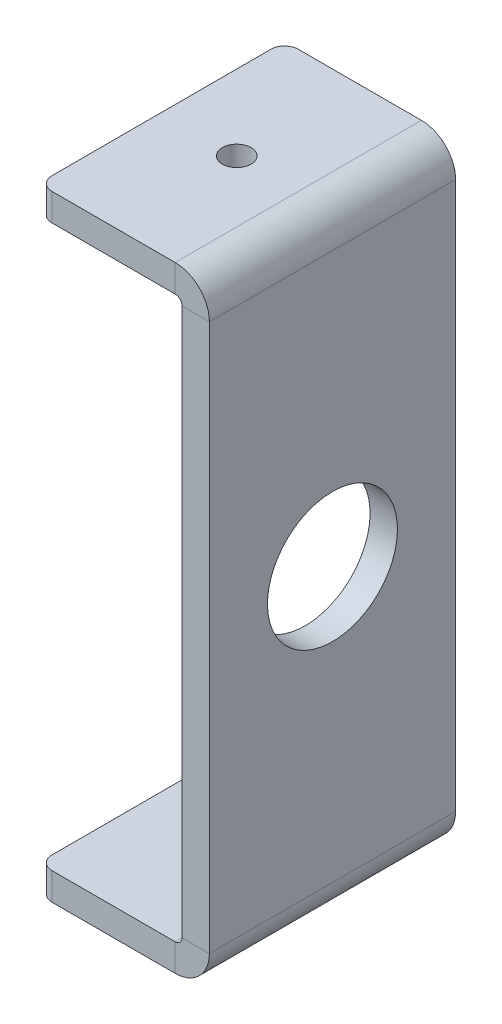
from build123d import *

# Parameters (mm, degrees)
BASE_FLANGE1_START    = -18
BASE_FLANGE1_DEPTH    = 36
FILLET1_R             = 2
M5_TAPPED_HOLE1_D     = 4.2
M5_TAPPED_HOLE1_DEPTH = 4
SKETCH8_R             = 9.5
CUT_EXTRUDE1_DEPTH    = 55.534392818


# Read off the part's stored shape, not the designer's step: Base-Flange1
with BuildPart() as part:
    # Base-Flange1 outline → Base-Flange1 (new body)
    with BuildSketch(Plane.XY.offset(BASE_FLANGE1_START)):
        with BuildLine():
            Line((-5, 45), (-25, 45))
            Line((-25, 45), (-25, 41))
            Line((-25, 41), (-5, 41))
            ThreePointArc((-5, 41), (-4.292893219, 40.707106781), (-4, 40))
            Line((-4, 40), (-4, -40))
            ThreePointArc((-4, -40), (-4.292893219, -40.707106781), (-5, -41))
            Line((-5, -41), (-25, -41))
            Line((-25, -41), (-25, -45))
            Line((-25, -45), (-5, -45))
            ThreePointArc((-5, -45), (-1.464466094, -43.535533906), (0, -40))
            Line((0, -40), (0, 40))
            ThreePointArc((0, 40), (-1.464466094, 43.535533906), (-5, 45))
        make_face()
    extrude(amount=BASE_FLANGE1_DEPTH)

    # Fillet1
    fillet1_edges = [part.edges().sort_by_distance(p)[0] for p in [
        (-25, -43, -18),
        (-25, 43, -18),
        (-25, -43, 18),
        (-25, 43, 18),
    ]]
    fillet(fillet1_edges, radius=FILLET1_R)

    # M5 Tapped Hole1
    with Locations(Plane(origin=(0, 45, 0), x_dir=(1, 0, 0), z_dir=(0, 1, 0))):
        with Locations((-14, 0)):
            m5_tapped_hole1 = Hole(M5_TAPPED_HOLE1_D / 2, depth=M5_TAPPED_HOLE1_DEPTH)

    # Mirror1: M5 Tapped Hole1 across plane
    add(m5_tapped_hole1.mirror(Plane.ZX), mode=Mode.SUBTRACT)

    # Sketch8 → Cut-Extrude1 (cut, through all)
    with BuildSketch(Plane(origin=(0, 0, 0), x_dir=(0, 0, -1), z_dir=(1, 0, 0))):
        with Locations(Location((0, 0, 0), (0, 0, 90))):
            Circle(SKETCH8_R)
    extrude(amount=-CUT_EXTRUDE1_DEPTH, mode=Mode.SUBTRACT)


solid = part.part
